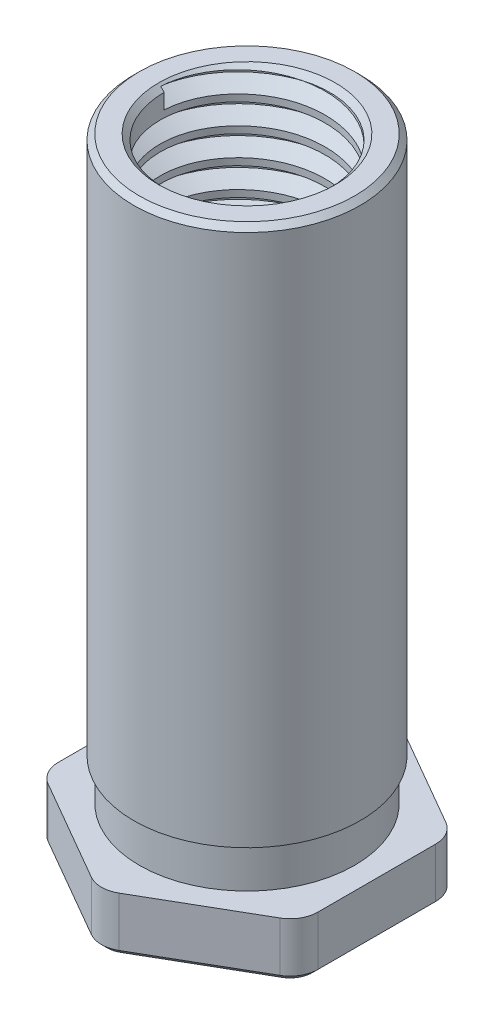
from build123d import *

# Parameters (mm, degrees)
SKETCH1_R              = 2.05
SKETCH1_R_2            = 1.95
EXTRUDE_HEX_DEPTH      = 1
SKETCH1_3_R            = 2.05
SKETCH1_3_R_2          = 1.95
EXTRUDE_CYLINDER_DEPTH = 10.5
SKETCH1_4_R            = 2.05
SKETCH1_4_R_2          = 1.95
CUT_CLINCHER_DEPTH     = 0.75
DRILL_3MM_D            = 3
DRILL_3MM_DEPTH        = 10
THREAD_M3_PITCH        = 0.5
FILLET_HEX_R           = 0.5
CHAMFER_VISUAL_SIZE    = 0.1


with BuildPart() as part:
    # Sketch1 → extrude hex (new body)
    # profile 1 of 3: a face of its own
    with BuildSketch(Plane(origin=(0, 0, 0), x_dir=(1, 0, 0), z_dir=(0, 1, 0))):
        Polygon((-2.35, 1.356773133), (-2.35, -1.356773133), (0, -2.713546265), (2.35, -1.356773133), (2.35, 1.356773133), (0, 2.713546265), align=None)
        Circle(SKETCH1_R, mode=Mode.SUBTRACT)
    # profile 2 of 3: a face of its own
    with BuildSketch(Plane(origin=(0, 0, 0), x_dir=(1, 0, 0), z_dir=(0, 1, 0))):
        Circle(SKETCH1_R)
        Circle(SKETCH1_R_2, mode=Mode.SUBTRACT)
    # profile 3 of 3: a face of its own
    with BuildSketch(Plane(origin=(0, 0, 0), x_dir=(1, 0, 0), z_dir=(0, 1, 0))):
        Circle(SKETCH1_R_2)
    extrude(amount=-EXTRUDE_HEX_DEPTH)

    # Sketch1<3> → extrude cylinder (add)
    with BuildSketch(Plane(origin=(0, 0, 0), x_dir=(1, 0, 0), z_dir=(0, 1, 0))):
        with Locations(Location((0, 0, 0), (0, 0, 90))):
            Circle(SKETCH1_3_R)
        Circle(SKETCH1_3_R_2)
    extrude(amount=EXTRUDE_CYLINDER_DEPTH)

    # Sketch1<4> → cut clincher (cut)
    with BuildSketch(Plane(origin=(0, 0, 0), x_dir=(1, 0, 0), z_dir=(0, 1, 0))):
        with Locations(Location((0, 0, 0), (0, 0, 90))):
            Circle(SKETCH1_4_R)
        with Locations(Location((0, 0, 0), (0, 0, 270))):
            Circle(SKETCH1_4_R_2, mode=Mode.SUBTRACT)
    extrude(amount=CUT_CLINCHER_DEPTH, mode=Mode.SUBTRACT)

    # drill 3mm
    with Locations(Plane(origin=(0, 10.5, 0), x_dir=(1, 0, 0), z_dir=(0, 1, 0))):
        with Locations((0, 0)):
            Hole(DRILL_3MM_D / 2, depth=DRILL_3MM_DEPTH)

    # thread m3: the profile of Thread Profile1 profile screwed along a right-hand helix of 20 turns, 6 arcs to a turn; built about Z, then put on its axis
    thread_m3_z = Axis((0, 0, 0), (0, 0, 1))
    thread_m3_corners = [(1.4997, 0, -0.000173205), (1.770632937, 0, 0.156249999), (1.770632937, 0, 0.218749999), (1.4997, 0, 0.375173204)]
    with BuildLine(mode=Mode.PRIVATE) as thread_m3_profile:
        Line(thread_m3_corners[0], thread_m3_corners[1])
        Line(thread_m3_corners[1], thread_m3_corners[2])
        Line(thread_m3_corners[2], thread_m3_corners[3])
        Line(thread_m3_corners[3], thread_m3_corners[0])
    thread_m3_cap = Face(thread_m3_profile.wire())
    thread_m3_turn_angles = [0, 30, 60, 90, 120, 150, 180, 210, 240, 270, 300, 330, 360]
    thread_m3_turn_weights = [1, 0.8660254037844387, 1, 0.8660254037844387, 1, 0.8660254037844387, 1, 0.8660254037844387, 1, 0.8660254037844387, 1, 0.8660254037844387, 1]
    thread_m3_turn_rails = [Edge.make_bspline([Vector(p[0], p[1], 0).rotate(thread_m3_z, thread_m3_turn_angles[k]) / thread_m3_turn_weights[k] + Vector(0, 0, p[2] + THREAD_M3_PITCH * thread_m3_turn_angles[k] / 360) for k in range(13)], [0, 0, 0, 1, 1, 2, 2, 3, 3, 4, 4, 5, 5, 6, 6, 6], 2, thread_m3_turn_weights) for p in thread_m3_corners]
    thread_m3_turn_sides = [Face.make_surface_from_curves(thread_m3_turn_rails[p[0]], thread_m3_turn_rails[p[1]]) for p in [(0, 1), (1, 2), (2, 3), (3, 0)]]
    thread_m3 = Plane(origin=(0, 10.5, 0), x_dir=(-1, 0, 0), z_dir=(0, -1, 0)) * Solid(Shell([*[p.moved(Location((0, 0, THREAD_M3_PITCH * i))) for i in range(20) for p in thread_m3_turn_sides], thread_m3_cap, thread_m3_cap.rotate(thread_m3_z, 7200).moved(Location((0, 0, THREAD_M3_PITCH * 7200 / 360)))]))
    add(thread_m3, mode=Mode.SUBTRACT)

    # fillet hex
    fillet_hex_edges = [part.edges().sort_by_distance(p)[0] for p in [
        (-2.35, -0.5, -1.356773133),
        (0, -0.5, -2.713546265),
        (2.35, -0.5, -1.356773133),
        (2.35, -0.5, 1.356773133),
        (0, -0.5, 2.713546265),
        (-2.35, -0.5, 1.356773133),
    ]]
    fillet(fillet_hex_edges, radius=FILLET_HEX_R)

    # chamfer visual
    # the kernel refuses this chamfer: 0.1 mm, written as the material it takes off along each edge
    with BuildSketch(Plane(origin=(0, 10.5, 0), x_dir=(0, 0, -1), z_dir=(1, 0, 0))) as chamfer_visual_piece_1:
        Polygon((2.05, -CHAMFER_VISUAL_SIZE), (2.05 - CHAMFER_VISUAL_SIZE, 0), (2.05, 0), align=None)
    revolve(axis=Axis((0, 10.5, 0), (0, 1, 0)), mode=Mode.SUBTRACT)
    with BuildSketch(Plane(origin=(0, 10.5, 0), x_dir=(-1, 0, 0), z_dir=(0, 0, 1))) as chamfer_visual_piece_2:
        Polygon((1.5 + CHAMFER_VISUAL_SIZE, 0), (1.5, CHAMFER_VISUAL_SIZE), (1.5, 0), align=None)
    revolve(axis=Axis((0, 10.5, 0), (0, -1, 0)), mode=Mode.SUBTRACT)
    with BuildSketch(Plane(origin=(-1.85, -1, 1.068097998), x_dir=(-1, 0, 0), z_dir=(0, 0, -1))) as chamfer_visual_piece_3:
        Polygon((0.5, CHAMFER_VISUAL_SIZE), (0.5 - CHAMFER_VISUAL_SIZE, 0), (0.5, 0), align=None)
    revolve(axis=Axis((-1.85, -1, 1.068097998), (0, 1, 0)), revolution_arc=60, mode=Mode.SUBTRACT)
    with BuildSketch(Plane(origin=(-2.1, -1, 1.5011107), x_dir=(0.49981095845564333, -0.02749587661058734, -0.8656979742248833), z_dir=(0.8660254037844416, 0, 0.49999999999999495)), Plane(origin=(0.25, -1, 2.569208698), x_dir=(-0.49981095845564916, -0.027495876610587354, -0.8656979742248798), z_dir=(0.8660254037844383, 0, -0.5000000000000009)), Plane(origin=(2.35, -1, 1.068097998), x_dir=(-0.9996219169112966, -0.027495876610587302, 3.599079508736667e-15), z_dir=(0, 0, -1)), Plane(origin=(2.1, -1, -1.5011107), x_dir=(-0.4998109584556432, -0.027495876610587392, 0.8656979742248833), z_dir=(-0.8660254037844416, 0, -0.49999999999999484)), Plane(origin=(-0.25, -1, -2.569208698), x_dir=(0.4998109584556554, -0.027495876610587375, 0.8656979742248764), z_dir=(-0.8660254037844347, 0, 0.500000000000007))) as chamfer_visual_piece_4:
        Polygon((CHAMFER_VISUAL_SIZE * 0.999621916911, CHAMFER_VISUAL_SIZE * 0.0274958766106), (-CHAMFER_VISUAL_SIZE * 0.0274958766106, CHAMFER_VISUAL_SIZE * 0.999621916911), (0, 0), align=None)
    extrude(amount=2.136195996, mode=Mode.SUBTRACT)
    with BuildSketch(Plane(origin=(0, -1, 2.136195996), x_dir=(-0.49999999999999484, 0, 0.8660254037844417), z_dir=(-0.8660254037844417, 0, -0.49999999999999484))) as chamfer_visual_piece_5:
        Polygon((0.5 - CHAMFER_VISUAL_SIZE, 0), (0.5, CHAMFER_VISUAL_SIZE), (0.5, 0), align=None)
    revolve(axis=Axis((0, -1, 2.136195996), (0, 1, 0)), revolution_arc=60, mode=Mode.SUBTRACT)
    with BuildSketch(Plane(origin=(1.85, -1, 1.068097998), x_dir=(0.5000000000000001, 0, 0.8660254037844386), z_dir=(-0.8660254037844386, 0, 0.5000000000000001))) as chamfer_visual_piece_6:
        Polygon((0.5 - CHAMFER_VISUAL_SIZE, 0), (0.5, CHAMFER_VISUAL_SIZE), (0.5, 0), align=None)
    revolve(axis=Axis((1.85, -1, 1.068097998), (0, 1, 0)), revolution_arc=60, mode=Mode.SUBTRACT)
    with BuildSketch(Plane(origin=(1.85, -1, -1.068097998), x_dir=(0.4999999999999948, 0, -0.8660254037844417), z_dir=(-0.8660254037844417, 0, -0.4999999999999948))) as chamfer_visual_piece_7:
        Polygon((0.5 - CHAMFER_VISUAL_SIZE, 0), (0.5, -CHAMFER_VISUAL_SIZE), (0.5, 0), align=None)
    revolve(axis=Axis((1.85, -1, -1.068097998), (0, -1, 0)), revolution_arc=60, mode=Mode.SUBTRACT)
    with BuildSketch(Plane(origin=(0, -1, -2.136195996), x_dir=(-0.5000000000000075, 0, -0.8660254037844343), z_dir=(-0.8660254037844343, 0, 0.5000000000000075))) as chamfer_visual_piece_8:
        Polygon((0.5 - CHAMFER_VISUAL_SIZE, 0), (0.5, -CHAMFER_VISUAL_SIZE), (0.5, 0), align=None)
    revolve(axis=Axis((0, -1, -2.136195996), (0, -1, 0)), revolution_arc=60, mode=Mode.SUBTRACT)
    with BuildSketch(Plane(origin=(-1.85, -1, -1.068097998), x_dir=(-1, 0, 0), z_dir=(0, 0, 1))) as chamfer_visual_piece_9:
        Polygon((0.5, -CHAMFER_VISUAL_SIZE), (0.5 - CHAMFER_VISUAL_SIZE, 0), (0.5, 0), align=None)
    revolve(axis=Axis((-1.85, -1, -1.068097998), (0, -1, 0)), revolution_arc=60, mode=Mode.SUBTRACT)
    with BuildSketch(Plane(origin=(-2.35, -1, -1.068097998), x_dir=(-0.02749587661058736, 0.9996219169112966, 0), z_dir=(0, 0, 1))) as chamfer_visual_piece_10:
        Polygon((CHAMFER_VISUAL_SIZE * 0.999621916911, -CHAMFER_VISUAL_SIZE * 0.0274958766106), (-CHAMFER_VISUAL_SIZE * 0.0274958766106, -CHAMFER_VISUAL_SIZE * 0.999621916911), (0, 0), align=None)
    extrude(amount=2.136195996, mode=Mode.SUBTRACT)


solid = part.part
